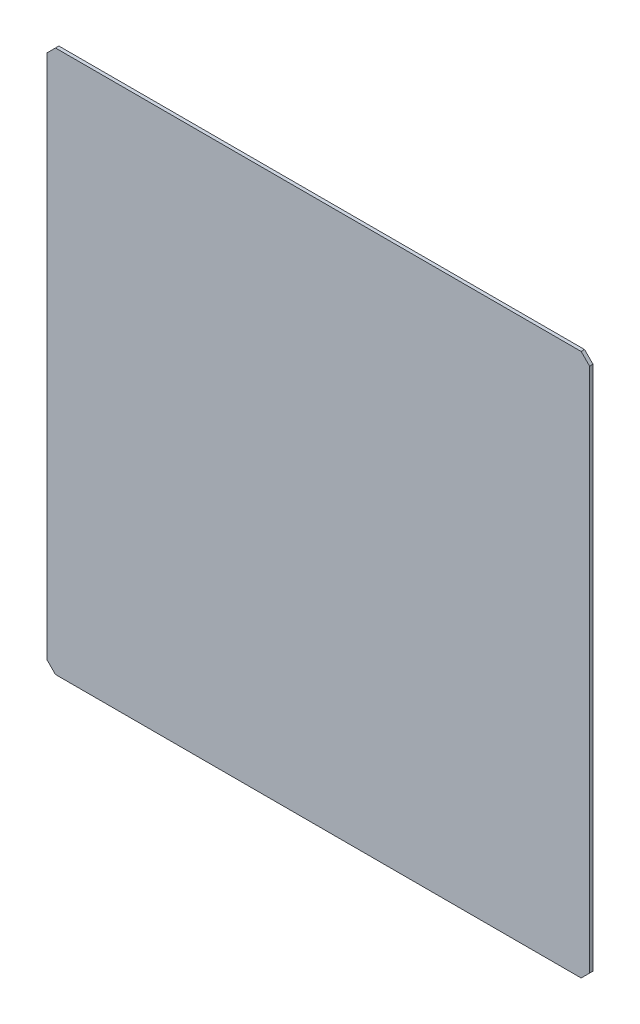
from build123d import *

# Parameters (mm, degrees)
SKETCH2_W           = 320
SKETCH2_H           = 320
BOSS_EXTRUDE1_DEPTH = 2
CHAMFER1_SIZE       = 5


with BuildPart() as part:
    # Sketch2 → Boss-Extrude1 (new body)
    with BuildSketch(Plane.XY):
        Rectangle(SKETCH2_W, SKETCH2_H)
    extrude(amount=BOSS_EXTRUDE1_DEPTH)

    # Chamfer1
    chamfer1_edges = [part.edges().sort_by_distance(p)[0] for p in [
        (-160, -160, 1),
        (-160, 160, 1),
        (160, 160, 1),
        (160, -160, 1),
    ]]
    chamfer(chamfer1_edges, length=CHAMFER1_SIZE)


solid = part.part
